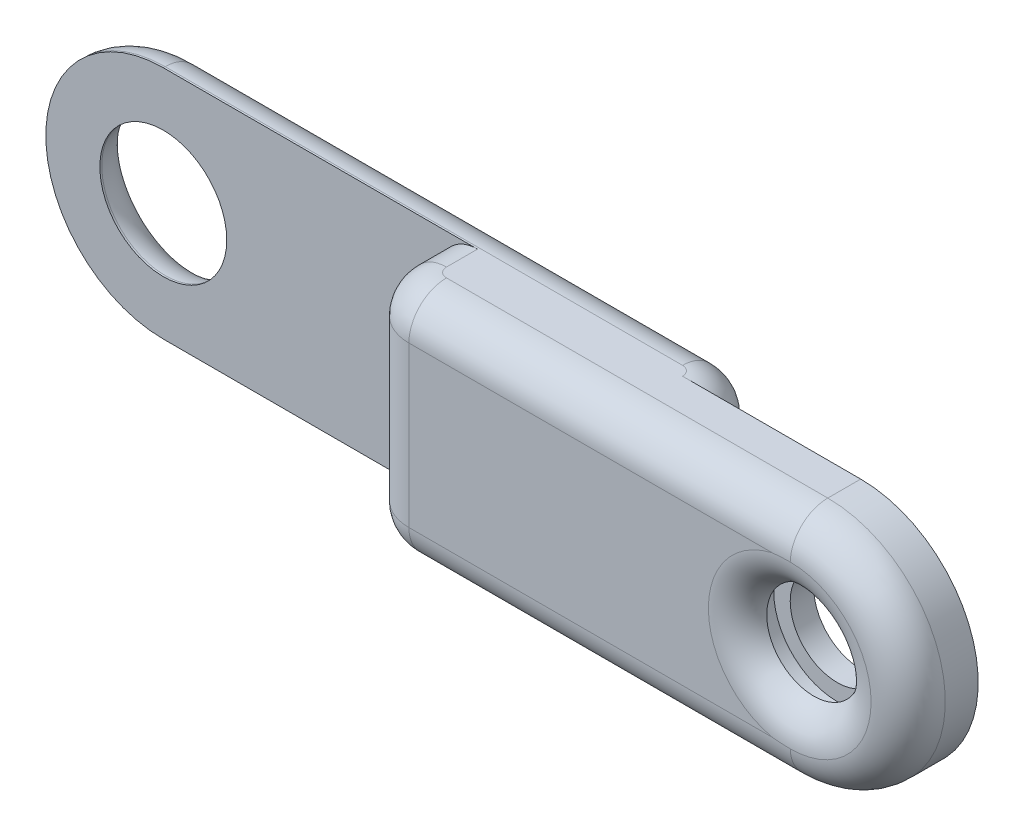
from build123d import *

# Parameters (mm, degrees)
BOSS_EXTRUDE1_DEPTH = 25
SKETCH2_R           = 13.5
CUT_EXTRUDE1_DEPTH  = 25
SKETCH3_R           = 13.5
CUT_EXTRUDE2_DEPTH  = 25
SKETCH4_R           = 13.5
SKETCH4_R_2         = 10
BOSS_EXTRUDE2_DEPTH = 5
BOSS_EXTRUDE3_START = -15
SKETCH5_R           = 13.5
SKETCH5_R_2         = 10
BOSS_EXTRUDE3_DEPTH = 15
CUT_EXTRUDE3_DEPTH  = 10
SKETCH7_R           = 13.468633883
BOSS_EXTRUDE4_DEPTH = 3
CUT_EXTRUDE4_START  = -16.6
CUT_EXTRUDE4_DEPTH  = 16.6
FILLET1_R           = 10
FILLET2_R           = 10
FILLET4_R           = 8


# Some blends are built 0.0001 mm under size
with BuildPart() as part:
    # Sketch1 → Boss-Extrude1 (new body)
    with BuildSketch(Plane.XY):
        with BuildLine():
            Line((-154.944852941, 25), (-4.944852941, 25))
            ThreePointArc((-4.944852941, 25), (20.055147059, 0), (-4.944852941, -25))
            Line((-4.944852941, -25), (-154.944852941, -25))
            ThreePointArc((-154.944852941, -25), (-179.944852941, 0), (-154.944852941, 25))
        make_face()
    extrude(amount=BOSS_EXTRUDE1_DEPTH)

    # Sketch2 → Cut-Extrude1 (cut)
    with BuildSketch(Plane.XY.offset(25)):
        with Locations((-4.944852941, 0)):
            Circle(SKETCH2_R)
    extrude(amount=-CUT_EXTRUDE1_DEPTH, mode=Mode.SUBTRACT)

    # Sketch3 → Cut-Extrude2 (cut)
    with BuildSketch(Plane.XY.offset(25)):
        with Locations((-154.944852941, 0)):
            Circle(SKETCH3_R)
    extrude(amount=-CUT_EXTRUDE2_DEPTH, mode=Mode.SUBTRACT)

    # Sketch4 → Boss-Extrude2 (add)
    with BuildSketch(Plane.XY.offset(25)):
        with Locations((-4.944852941, 0)):
            Circle(SKETCH4_R)
        with Locations((-4.944852941, 0)):
            Circle(SKETCH4_R_2, mode=Mode.SUBTRACT)
    extrude(amount=-BOSS_EXTRUDE2_DEPTH)

    # Sketch5 → Boss-Extrude3 (add)
    with BuildSketch(Plane(origin=(0, 0, 0), x_dir=(-1, 0, 0), z_dir=(0, 0, -1)).offset(BOSS_EXTRUDE3_START)):
        with Locations(Location((4.944852941, 0, 0), (0, 0, 180))):
            Circle(SKETCH5_R)
        with Locations(Location((4.944852941, 0, 0), (0, 0, 180))):
            Circle(SKETCH5_R_2, mode=Mode.SUBTRACT)
    extrude(amount=BOSS_EXTRUDE3_DEPTH)

    # Sketch6 → Cut-Extrude3 (cut)
    with BuildSketch(Plane(origin=(0, 0, 0), x_dir=(-1, 0, 0), z_dir=(0, 0, -1))):
        with BuildLine():
            Line((4.944852941, 25), (34.850592548, 25))
            Line((34.850592548, 25), (34.850592548, -25))
            Line((34.850592548, -25), (4.944852941, -25))
            ThreePointArc((4.944852941, -25), (-20.055147059, 0), (4.944852941, 25))
        make_face()
    extrude(amount=-CUT_EXTRUDE3_DEPTH, mode=Mode.SUBTRACT)


with BuildPart() as body_2:
    # Sketch7 → Boss-Extrude4 (new body)
    with BuildSketch(Plane.XY.offset(25)):
        with Locations((-154.944852941, 0)):
            Circle(SKETCH7_R)
    extrude(amount=-BOSS_EXTRUDE4_DEPTH)


with BuildPart() as cut_extrude4_tool:
    # Sketch9 → Cut-Extrude4 (new body)
    with BuildSketch(Plane.XY.offset(25).offset(CUT_EXTRUDE4_START)):
        with BuildLine():
            Line((-96.084788757, 25), (-96.084788757, -25))
            Line((-96.084788757, -25), (-154.944852941, -25))
            ThreePointArc((-154.944852941, -25), (-179.944852941, 0), (-154.944852941, 25))
            Line((-154.944852941, 25), (-96.084788757, 25))
        make_face()
    extrude(amount=CUT_EXTRUDE4_DEPTH)


with BuildPart() as part_1:
    add(part.part)

    # Cut-Extrude4: cut by cut_extrude4_tool
    add(cut_extrude4_tool.part, mode=Mode.SUBTRACT)

    # Fillet1
    fillet1_edges = [part_1.edges().sort_by_distance(p)[0] for p in [
        (-96.084788757, 0, 25),
    ]]
    fillet(fillet1_edges, radius=FILLET1_R)

    # Fillet2
    fillet2_edges = [part_1.edges().sort_by_distance(p)[0] for p in [
        (-34.850592548, 0, 0),
    ]]
    fillet(fillet2_edges, radius=FILLET2_R - 0.0001)  # a hair under: the kernel refuses the full size

    # Fillet4
    # the kernel refuses this fillet: 8 mm, written as the material it takes off along each edge
    with BuildSketch(Plane(origin=(-4.944852941, 0, 25), x_dir=(0, 1, 0), z_dir=(-1, 0, 0))) as fillet4_piece_1:
        with BuildLine():
            CenterArc((25 - FILLET4_R, FILLET4_R), FILLET4_R, 270, 90)
            Line((25 - FILLET4_R, 0), (25, 0))
            Line((25, 0), (25, FILLET4_R))
        make_face()
    revolve(axis=Axis((-4.944852941, 0, 25), (0, 0, -1)), revolution_arc=180, mode=Mode.SUBTRACT)
    with BuildSketch(Plane(origin=(-86.084788757, 25, 25), x_dir=(0, -1, 0), z_dir=(1, 0, 0))) as fillet4_piece_2:
        with BuildLine():
            CenterArc((FILLET4_R, FILLET4_R), FILLET4_R, 180, 90)
            Line((0, FILLET4_R), (0, 0))
            Line((0, 0), (FILLET4_R, 0))
        make_face()
    extrude(amount=81.139935816, mode=Mode.SUBTRACT)
    with BuildSketch(Plane(origin=(-154.944852941, 0, 0), x_dir=(1, 0, 0), z_dir=(0, -1, 0))) as fillet4_piece_3:
        with BuildLine():
            CenterArc((13.5 + FILLET4_R, FILLET4_R), FILLET4_R, 180, 90)
            Line((13.5, FILLET4_R), (13.5, 0))
            Line((13.5, 0), (13.5 + FILLET4_R, 0))
        make_face()
    revolve(axis=Axis((-154.944852941, 0, 0), (0, 0, 1)), mode=Mode.SUBTRACT)
    with BuildSketch(Plane(origin=(-4.944852941, 0, 25), x_dir=(1, 0, 0), z_dir=(0, -1, 0))) as fillet4_piece_4:
        with BuildLine():
            CenterArc((17.416198487, -8), FILLET4_R, 90, 67.975687163)
            Line((10, -5), (10, 0))
            Line((10, 0), (17.416198487, 0))
        make_face()
    revolve(axis=Axis((-4.944852941, 0, 25), (0, 0, 1)), mode=Mode.SUBTRACT)
    with BuildSketch(Plane(origin=(-44.850492548, -25, 0), x_dir=(0, 0, 1), z_dir=(-1, 0, 0))) as fillet4_piece_5:
        with BuildLine():
            CenterArc((FILLET4_R, FILLET4_R), FILLET4_R, 180, 90)
            Line((0, FILLET4_R), (0, 0))
            Line((0, 0), (FILLET4_R, 0))
        make_face()
    extrude(amount=110.094360393, mode=Mode.SUBTRACT)
    with BuildSketch(Plane(origin=(-154.944852941, 0, 0), x_dir=(0, -1, 0), z_dir=(1, 0, 0))) as fillet4_piece_6:
        with BuildLine():
            CenterArc((25 - FILLET4_R, -FILLET4_R), FILLET4_R, 0, 90)
            Line((25, -FILLET4_R), (25, 0))
            Line((25, 0), (25 - FILLET4_R, 0))
        make_face()
    revolve(axis=Axis((-154.944852941, 0, 0), (0, 0, -1)), revolution_arc=180, mode=Mode.SUBTRACT)
    with BuildSketch(Plane(origin=(-96.084788757, 25, 8.4), x_dir=(0, -1, 0), z_dir=(0, 0, 1)), Plane(origin=(-96.084788757, -25, 8.4), x_dir=(1, 0, 0), z_dir=(0, 0, 1))) as fillet4_piece_7:
        with BuildLine():
            CenterArc((FILLET4_R, FILLET4_R), FILLET4_R, 180, 90)
            Line((0, FILLET4_R), (0, 0))
            Line((0, 0), (FILLET4_R, 0))
        make_face()
    extrude(amount=6.6, mode=Mode.SUBTRACT)
    with BuildSketch(Plane(origin=(-86.084788757, 25, 15), x_dir=(-1, 0, 0), z_dir=(0, 0, -1))) as fillet4_piece_8:
        with BuildLine():
            CenterArc((10 - FILLET4_R, -FILLET4_R), FILLET4_R, 0, 90)
            Line((10 - FILLET4_R, 0), (10, 0))
            Line((10, 0), (10, -FILLET4_R))
        make_face()
    revolve(axis=Axis((-86.084788757, 25, 15), (0, 1, 0)), revolution_arc=90, mode=Mode.SUBTRACT)
    with BuildSketch(Plane(origin=(-4.944852941, -25, 25), x_dir=(0, 0, -1), z_dir=(-1, 0, 0))) as fillet4_piece_9:
        with BuildLine():
            CenterArc((FILLET4_R, -FILLET4_R), FILLET4_R, 90, 90)
            Line((0, -FILLET4_R), (0, 0))
            Line((0, 0), (FILLET4_R, 0))
        make_face()
    extrude(amount=81.139935816, mode=Mode.SUBTRACT)
    with BuildSketch(Plane(origin=(-86.084788757, -25, 15), x_dir=(-1, 0, 0), z_dir=(0, 0, -1))) as fillet4_piece_10:
        with BuildLine():
            CenterArc((10 - FILLET4_R, FILLET4_R), FILLET4_R, 270, 90)
            Line((10, FILLET4_R), (10, 0))
            Line((10, 0), (10 - FILLET4_R, 0))
        make_face()
    revolve(axis=Axis((-86.084788757, -25, 15), (0, 1, 0)), revolution_arc=90, mode=Mode.SUBTRACT)
    with BuildSketch(Plane(origin=(-154.944852941, 25, 0), x_dir=(0, -1, 0), z_dir=(1, 0, 0))) as fillet4_piece_11:
        with BuildLine():
            CenterArc((FILLET4_R, -FILLET4_R), FILLET4_R, 90, 90)
            Line((0, -FILLET4_R), (0, 0))
            Line((0, 0), (FILLET4_R, 0))
        make_face()
    extrude(amount=110.094360393, mode=Mode.SUBTRACT)
    with BuildSketch(Plane(origin=(-44.850492548, 25, 9.9999), x_dir=(0, 0, -1), z_dir=(-1, 0, 0))) as fillet4_piece_12:
        with BuildLine():
            CenterArc((9.9999 - FILLET4_R, FILLET4_R), FILLET4_R, 270, 90)
            Line((9.9999 - FILLET4_R, 0), (9.9999, 0))
            Line((9.9999, 0), (9.9999, FILLET4_R))
        make_face()
    revolve(axis=Axis((-44.850492548, 25, 9.9999), (0, -1, 0)), revolution_arc=90, mode=Mode.SUBTRACT)
    with BuildSketch(Plane(origin=(-44.850492548, -25, 9.9999), x_dir=(0, 0, -1), z_dir=(-1, 0, 0))) as fillet4_piece_13:
        with BuildLine():
            CenterArc((9.9999 - FILLET4_R, -FILLET4_R), FILLET4_R, 0, 90)
            Line((9.9999, -FILLET4_R), (9.9999, 0))
            Line((9.9999, 0), (9.9999 - FILLET4_R, 0))
        make_face()
    revolve(axis=Axis((-44.850492548, -25, 9.9999), (0, -1, 0)), revolution_arc=90, mode=Mode.SUBTRACT)
    with BuildSketch(Plane(origin=(-34.850592548, -25, 9.9999), x_dir=(-1, 0, 0), z_dir=(0, 0, 1)), Plane(origin=(-34.850592548, 25, 9.9999), x_dir=(0, -1, 0), z_dir=(0, 0, 1))) as fillet4_piece_14:
        with BuildLine():
            CenterArc((FILLET4_R, -FILLET4_R), FILLET4_R, 90, 90)
            Line((0, -FILLET4_R), (0, 0))
            Line((0, 0), (FILLET4_R, 0))
        make_face()
    extrude(amount=0.0001, mode=Mode.SUBTRACT)


with BuildPart() as body_2_1:
    add(body_2.part)

    # Cut-Extrude4: cut by cut_extrude4_tool
    add(cut_extrude4_tool.part, mode=Mode.SUBTRACT)


solid = part_1.part
